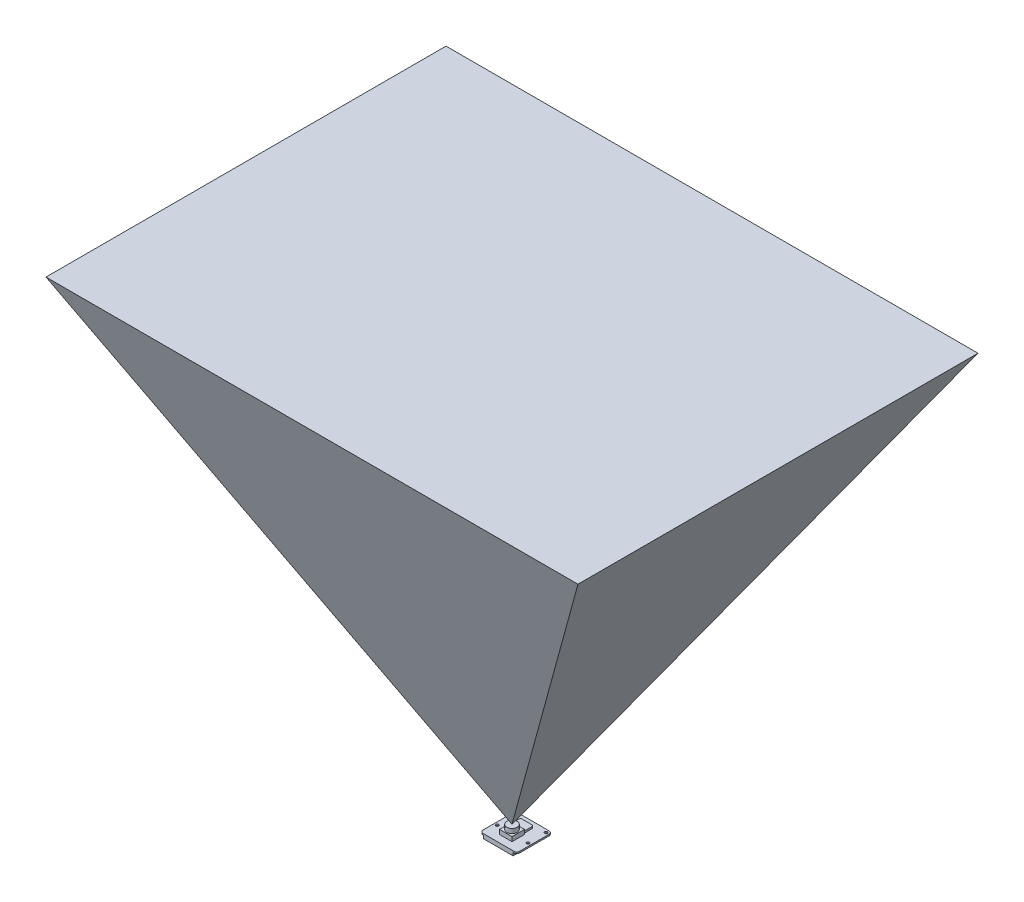
from build123d import *

# Parameters (mm, degrees)
SKETCH1_W           = 25
SKETCH1_H           = 24
BOSS_EXTRUDE1_DEPTH = 1
SKETCH2_W           = 8.5
SKETCH2_H           = 8.5
BOSS_EXTRUDE2_DEPTH = 3
SKETCH3_R           = 3.5
BOSS_EXTRUDE3_DEPTH = 3
SKETCH4_W           = 20
SKETCH4_H           = 5.4
BOSS_EXTRUDE4_DEPTH = 2
SKETCH5_R           = 1
CUT_EXTRUDE1_DEPTH  = 36.17101079
FILLET1_R           = 2
BOSS_EXTRUDE5_DEPTH = 200
BOSS_EXTRUDE6_DEPTH = 200
BOSS_EXTRUDE7_DEPTH = 1.3
FILLET2_R           = 1


with BuildPart() as part:
    # Sketch1 → Boss-Extrude1 (new body)
    with BuildSketch(Plane(origin=(0, 0, 0), x_dir=(1, 0, 0), z_dir=(0, 1, 0))):
        with Locations((12.5, 12)):
            Rectangle(SKETCH1_W, SKETCH1_H)
    extrude(amount=BOSS_EXTRUDE1_DEPTH)

    # Sketch2 → Boss-Extrude2 (add)
    with BuildSketch(Plane(origin=(0, 1, 0), x_dir=(1, 0, 0), z_dir=(0, 1, 0))):
        with Locations((12.5, 9.25)):
            Rectangle(SKETCH2_W, SKETCH2_H)
    extrude(amount=BOSS_EXTRUDE2_DEPTH)

    # Sketch3 → Boss-Extrude3 (add)
    with BuildSketch(Plane(origin=(0, 4, 0), x_dir=(1, 0, 0), z_dir=(0, 1, 0))):
        with Locations(Location((12.5, 9.25, 0), (0, 0, 90))):
            Circle(SKETCH3_R)
    extrude(amount=BOSS_EXTRUDE3_DEPTH)

    # Sketch4 → Boss-Extrude4 (add)
    with BuildSketch(Plane.XZ):
        with Locations((12.5, -2.7)):
            Rectangle(SKETCH4_W, SKETCH4_H)
    extrude(amount=BOSS_EXTRUDE4_DEPTH)

    # Sketch5 → Cut-Extrude1 (cut, through all)
    with BuildSketch(Plane(origin=(0, 1, 0), x_dir=(1, 0, 0), z_dir=(0, 1, 0))):
        with Locations(Location((2, 9.7, 0), (0, 0, 270))):
            Circle(SKETCH5_R)
        with Locations(Location((2, 22, 0), (0, 0, 270))):
            Circle(SKETCH5_R)
        with Locations(Location((23, 22, 0), (0, 0, 270))):
            Circle(SKETCH5_R)
        with Locations(Location((23, 9.7, 0), (0, 0, 270))):
            Circle(SKETCH5_R)
    extrude(amount=-CUT_EXTRUDE1_DEPTH, mode=Mode.SUBTRACT)

    # Fillet1
    fillet1_edges = [part.edges().sort_by_distance(p)[0] for p in [
        (0, 0.5, -24),
        (25, 0.5, -24),
        (25, 0.5, 0),
        (0, 0.5, 0),
    ]]
    fillet(fillet1_edges, radius=FILLET1_R)

    # Sketch9 → Boss-Extrude7 (add)
    with BuildSketch(Plane(origin=(0, 1, 0), x_dir=(1, 0, 0), z_dir=(0, 1, 0))):
        Polygon((15.925, 13.5), (15.925, 20.45), (7.075, 20.45), (7.075, 16.55), (9.075, 16.55), (9.075, 13.5), align=None)
    extrude(amount=BOSS_EXTRUDE7_DEPTH)

    # Fillet2
    fillet2_edges = [part.edges().sort_by_distance(p)[0] for p in [
        (9.075, 1.65, -16.55),
        (7.075, 1.65, -16.55),
        (15.925, 1.65, -20.45),
        (7.075, 1.65, -20.45),
    ]]
    fillet(fillet2_edges, radius=FILLET2_R - 0.0001)  # a hair under: the kernel refuses the full size


with BuildPart() as body_2:
    # Sketch6 → Boss-Extrude5 (new, symmetric)
    with BuildSketch(Plane(origin=(0, 0, 0), x_dir=(0, 0, -1), z_dir=(1, 0, 0))):
        Polygon((9.25, 7), (-126.836035449, 307), (145.336035449, 307), align=None)
    extrude(amount=BOSS_EXTRUDE5_DEPTH, both=True)


with BuildPart() as body_3:
    # Sketch8 → Boss-Extrude6 (new, symmetric)
    with BuildSketch(Plane.XY):
        Polygon((12.5, 7), (-168.471570024, 307), (193.471570024, 307), align=None)
    extrude(amount=BOSS_EXTRUDE6_DEPTH, both=True)

    # Intersect1: read off the stored shape, not the designer's step
    # Intersect1: intersect body 2
    add(body_2.part, mode=Mode.INTERSECT)


solid = Compound([part.part, body_3.part])
